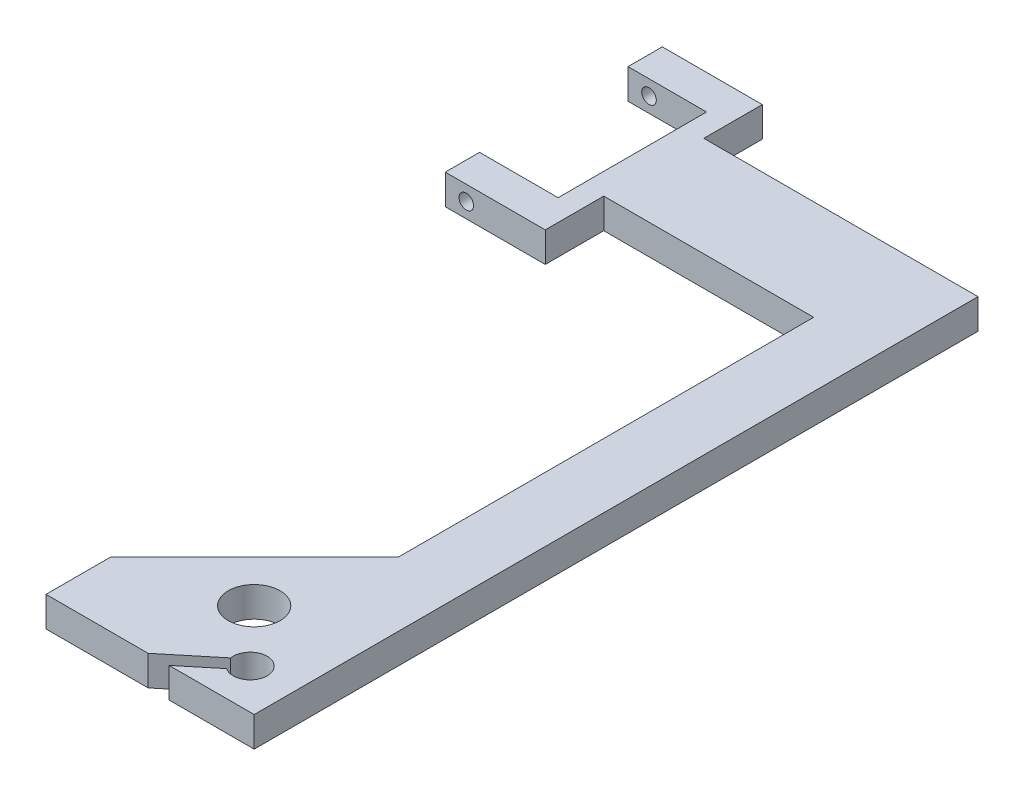
from build123d import *

# Parameters (mm, degrees)
SKETCH1_R           = 6.05
BOSS_EXTRUDE1_DEPTH = 7
SKETCH2_R           = 1.7
CUT_EXTRUDE1_DEPTH  = 60


with BuildPart() as part:
    # Sketch1 → Boss-Extrude1 (new body)
    with BuildSketch(Plane(origin=(0, 0, 0), x_dir=(1, 0, 0), z_dir=(0, 1, 0))):
        with BuildLine():
            Line((23.34, 33.594821988), (23.34, 19.944821988))
            Line((23.34, 19.944821988), (0, 19.944821988))
            Line((0, 19.944821988), (0, 27.944821988))
            Line((0, 27.944821988), (18.34, 27.944821988))
            Line((18.34, 27.944821988), (18.34, 62.594821988))
            Line((18.34, 62.594821988), (0, 62.594821988))
            Line((0, 62.594821988), (0, 70.594821988))
            Line((0, 70.594821988), (23.34, 70.594821988))
            Line((23.34, 70.594821988), (23.34, 56.944821988))
            Line((23.34, 56.944821988), (87.34, 56.944821988))
            Line((87.34, 56.944821988), (87.34, -63.405178012))
            Line((87.34, -63.405178012), (87.34, -111.995178012))
            Line((87.34, -111.995178012), (67.474963518, -111.995178012))
            Line((67.474963518, -111.995178012), (74.836720099, -105.938267514))
            ThreePointArc((74.836720099, -105.938267514), (80.41114952, -100.522105898), (73.149521611, -103.292995672))
            Line((73.149521611, -103.292995672), (62.572619718, -111.995178012))
            Line((62.572619718, -111.995178012), (38.75, -111.995178012))
            Line((38.75, -111.995178012), (38.75, -96.995178012))
            Line((38.75, -96.995178012), (72.34, -63.405178012))
            Line((72.34, -63.405178012), (72.34, 33.594821988))
            Line((72.34, 33.594821988), (23.34, 33.594821988))
        make_face()
        with Locations((65.34, -89.995178012)):
            Circle(SKETCH1_R, mode=Mode.SUBTRACT)
    extrude(amount=BOSS_EXTRUDE1_DEPTH)

    # Sketch2 → Cut-Extrude1 (cut)
    with BuildSketch(Plane.XY.offset(-19.944821988)):
        with Locations((4.9, 3.5)):
            Circle(SKETCH2_R)
    extrude(amount=-CUT_EXTRUDE1_DEPTH, mode=Mode.SUBTRACT)


solid = part.part
